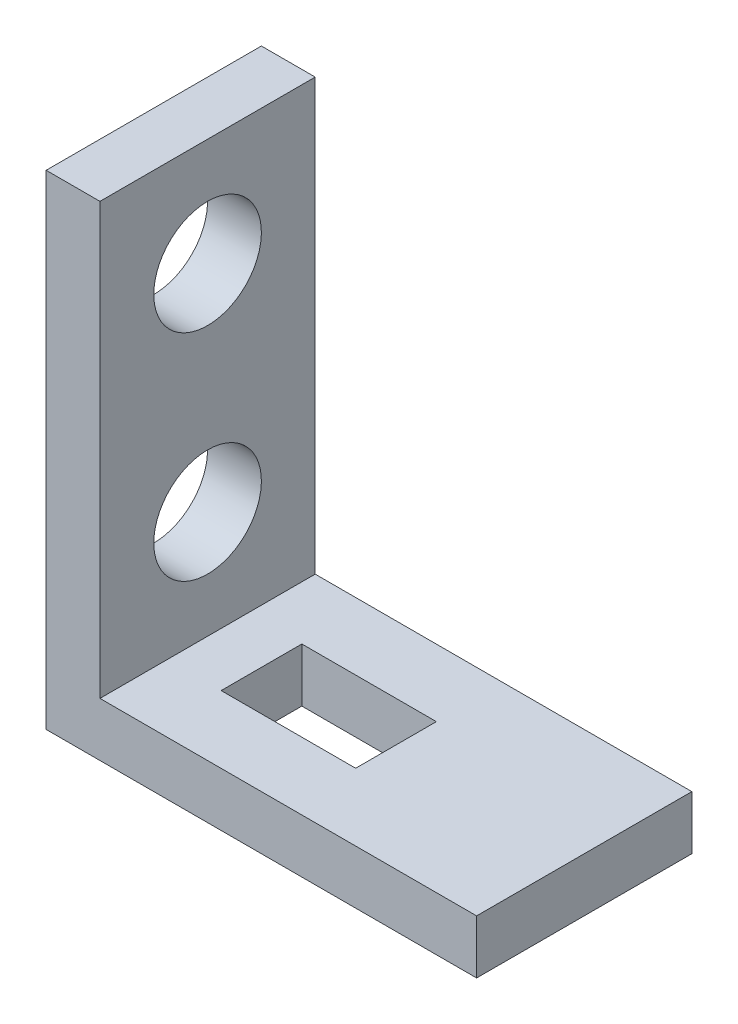
from build123d import *

# Parameters (mm, degrees)
BOSS_EXTRUDE1_DEPTH = 12.7
SKETCH2_R           = 3.175
CUT_EXTRUDE1_DEPTH  = 39.363670966
SKETCH4_W           = 7.9375
SKETCH4_H           = 4.7625
CUT_EXTRUDE2_DEPTH  = 39.1


with BuildPart() as part:
    # Sketch1 → Boss-Extrude1 (new body)
    with BuildSketch(Plane.XY):
        Polygon((0, 0), (25.4, 0), (25.4, 3.175), (3.175, 3.175), (3.175, 28.575), (0, 28.575), align=None)
    extrude(amount=BOSS_EXTRUDE1_DEPTH)

    # Sketch2 → Cut-Extrude1 (cut, through all)
    with BuildSketch(Plane(origin=(3.175, 0, 0), x_dir=(0, 0, -1), z_dir=(1, 0, 0))):
        with Locations((-6.35, 22.225)):
            Circle(SKETCH2_R)
        with Locations((-6.35, 9.525)):
            Circle(SKETCH2_R)
    extrude(amount=-CUT_EXTRUDE1_DEPTH, mode=Mode.SUBTRACT)

    # Sketch4 → Cut-Extrude2 (cut, through all)
    with BuildSketch(Plane(origin=(0, 3.175, 0), x_dir=(1, 0, 0), z_dir=(0, 1, 0))):
        with Locations((10.31875, -6.34365)):
            Rectangle(SKETCH4_W, SKETCH4_H)
    extrude(amount=-CUT_EXTRUDE2_DEPTH, mode=Mode.SUBTRACT)


solid = part.part
